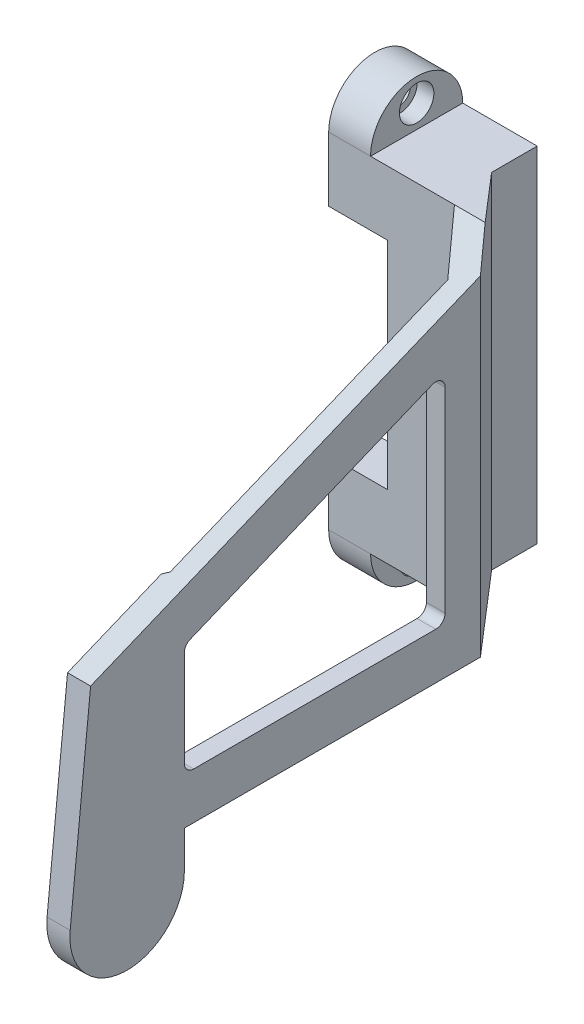
from build123d import *

# Parameters (mm, degrees)
SZKIC1_W                       = 9.9
SZKIC1_H                       = 37
DODANIE_WYCI_GNI_CIE1_DEPTH    = 12.5
DODANIE_WYCI_GNI_CIE2_DEPTH    = 7.5
WYTNIJ_WYCI_GNI_CIE1_START     = -47.15
WYTNIJ_WYCI_GNI_CIE1_OUTLINE_W = 17.51973865
WYTNIJ_WYCI_GNI_CIE1_OUTLINE_H = 49.213267073
WYTNIJ_WYCI_GNI_CIE1_DEPTH     = 47.15
SZKIC4_W                       = 6.3
SZKIC4_H                       = 23.2
WYTNIJ_WYCI_GNI_CIE2_DEPTH     = 57.5
BOSS_EXTRU_1_START             = -2.480261
ESQUISSE2_R                    = 1.8
BOSS_EXTRU_1_DEPTH             = 3
ENL_V_MAT_EXTRU_1_DEPTH        = 72.402310887
ESQUISSE4_W                    = 2.9
ESQUISSE4_H                    = 5.1
ENL_V_MAT_EXTRU_2_DEPTH        = 6.3
BOSS_EXTRU_2_DEPTH             = 37
ESQUISSE6_R                    = 1.1
BOSS_EXTRU_3_DEPTH             = 4.5
ENL_V_START                    = -1.8
ESQUISSE8_R                    = 1.85
ESQUISSE8_R_2                  = 1.1
ENL_V_MAT_EXTRU_5_DEPTH        = 1.8
BOSS_EXTRU_4_REACH             = 76.088
ENL_V_MAT_EXTRU_7_DEPTH        = 75.088410025
ENL_V_MAT_EXTRU_8_DEPTH        = 66.729440163


# Read off the part's stored shape, not the designer's step: Wytnij-wyciągnięcie1
with BuildPart() as part:
    # Szkic1 → Dodanie-wyciągnięcie1 (new body)
    with BuildSketch(Plane(origin=(0, 0, 0), x_dir=(0, 0, -1), z_dir=(1, 0, 0))):
        with Locations((-4.95, 18.5)):
            Rectangle(SZKIC1_W, SZKIC1_H)
    extrude(amount=DODANIE_WYCI_GNI_CIE1_DEPTH)

    # Szkic2 → Dodanie-wyciągnięcie2 (add)
    with BuildSketch(Plane(origin=(12.5, 0, 0), x_dir=(0, 0, -1), z_dir=(1, 0, 0))):
        with BuildLine():
            Line((-45.4, 0), (-7.4, 0))
            Line((-7.4, 0), (-7.4, 37))
            Line((-7.4, 37), (-9.9, 37))
            Line((-9.9, 37), (-55.472391365, 18.25))
            Line((-55.472391365, 18.25), (-57.668539629, -3.378732899))
            ThreePointArc((-57.668539629, -3.378732899), (-51.861031576, -10.142129872), (-45.4, -4))
            Line((-45.4, -4), (-45.4, 0))
        make_face()
    extrude(amount=DODANIE_WYCI_GNI_CIE2_DEPTH)

    # Wytnij-wyciągnięcie1 outline → Wytnij-wyciągnięcie1 (cut)
    with BuildSketch(Plane(origin=(0, 37, 0), x_dir=(1, 0, 0), z_dir=(0, 1, 0)).offset(WYTNIJ_WYCI_GNI_CIE1_START)):
        with Locations((8.759869325, -38.061906093)):
            Rectangle(WYTNIJ_WYCI_GNI_CIE1_OUTLINE_W, WYTNIJ_WYCI_GNI_CIE1_OUTLINE_H)
        Polygon((15, -7.4), (20, -12.4), (20, -7.4), align=None)
    extrude(amount=WYTNIJ_WYCI_GNI_CIE1_DEPTH, mode=Mode.SUBTRACT)

    # Szkic4 → Wytnij-wyciągnięcie2 (cut)
    with BuildSketch(Plane.XY.offset(9.9)):
        with Locations((3.15, 18.5)):
            Rectangle(SZKIC4_W, SZKIC4_H)
    extrude(amount=-WYTNIJ_WYCI_GNI_CIE2_DEPTH, mode=Mode.SUBTRACT)

    # Esquisse2 → Boss.-Extru.1 (add)
    with BuildSketch(Plane(origin=(20, 0, 0), x_dir=(0, 0, -1), z_dir=(1, 0, 0)).offset(BOSS_EXTRU_1_START)):
        with Locations((-51.55, -4)):
            Circle(ESQUISSE2_R)
    extrude(amount=-BOSS_EXTRU_1_DEPTH)

    # Esquisse3 → Enlèv. mat.-Extru.1 (cut, through all)
    with BuildSketch(Plane(origin=(20, 0, 0), x_dir=(0, 0, -1), z_dir=(1, 0, 0))):
        with BuildLine():
            Line((-17.4, 6), (-17.4, 27.014829056))
            ThreePointArc((-17.4, 27.014829056), (-17.843442614, 27.845638225), (-18.780487752, 27.939615015))
            Line((-18.780487752, 27.939615015), (-44.780487752, 17.242348855))
            ThreePointArc((-44.780487752, 17.242348855), (-45.230809169, 16.874120282), (-45.4, 16.317562896))
            Line((-45.4, 16.317562896), (-45.4, 6))
            ThreePointArc((-45.4, 6), (-45.107106781, 5.292893219), (-44.4, 5))
            Line((-44.4, 5), (-18.4, 5))
            ThreePointArc((-18.4, 5), (-17.692893219, 5.292893219), (-17.4, 6))
        make_face()
    extrude(amount=-ENL_V_MAT_EXTRU_1_DEPTH, mode=Mode.SUBTRACT)

    # Esquisse4 → Enlèv. mat.-Extru.2 (cut)
    with BuildSketch(Plane.ZY):
        with Locations((3.95, 32.65)):
            Rectangle(ESQUISSE4_W, ESQUISSE4_H)
        with Locations((3.95, 4.35)):
            Rectangle(ESQUISSE4_W, ESQUISSE4_H)
    extrude(amount=-ENL_V_MAT_EXTRU_2_DEPTH, mode=Mode.SUBTRACT)

    # Esquisse5 → Boss.-Extru.2 (add)
    with BuildSketch(Plane.XZ):
        Polygon((12.5, 4.9), (15, 7.4), (12.5, 7.4), align=None)
    extrude(amount=-BOSS_EXTRU_2_DEPTH)

    # Esquisse6 → Boss.-Extru.3 (add)
    # profile 1 of 3: a face of its own
    with BuildSketch(Plane.ZY):
        Polygon((2.5, 30.1), (2.5, 35.2), (5.4, 35.2), (5.4, 30.1), (9.9, 30.1), (9.9, 37), (0, 37), (0, 30.1), align=None)
    # profile 2 of 3: a face of its own
    with BuildSketch(Plane.ZY):
        with BuildLine():
            ThreePointArc((9.9, 37), (4.95, 41.95), (0, 37))
            Line((0, 37), (9.9, 37))
        make_face()
        with Locations((4.95, 39.475)):
            Circle(ESQUISSE6_R, mode=Mode.SUBTRACT)
    # profile 3 of 3: a face of its own
    with BuildSketch(Plane.ZY):
        with BuildLine():
            ThreePointArc((0, 0), (4.95, -4.95), (9.9, 0))
            Line((9.9, 0), (0, 0))
        make_face()
        with Locations((4.95, -2.475)):
            Circle(ESQUISSE6_R, mode=Mode.SUBTRACT)
    extrude(amount=-BOSS_EXTRU_3_DEPTH)

    # Esquisse8 → Enlèv. mat.-Extru.5 (cut)
    # profile 1 of 2: a face of its own
    with BuildSketch(Plane(origin=(4.5, 0, 0), x_dir=(0, 0, -1), z_dir=(1, 0, 0)).offset(ENL_V_START)):
        with Locations((-4.95, 39.475)):
            Circle(ESQUISSE8_R)
        with Locations(Location((-4.95, 39.475, 0), (0, 0, 180))):
            Circle(ESQUISSE8_R_2, mode=Mode.SUBTRACT)
    # profile 2 of 2: a face of its own
    with BuildSketch(Plane(origin=(4.5, 0, 0), x_dir=(0, 0, -1), z_dir=(1, 0, 0)).offset(ENL_V_START)):
        with Locations((-4.95, -2.475)):
            Circle(ESQUISSE8_R)
        with Locations(Location((-4.95, -2.475, 0), (0, 0, 180))):
            Circle(ESQUISSE8_R_2, mode=Mode.SUBTRACT)
    extrude(amount=ENL_V_MAT_EXTRU_5_DEPTH, mode=Mode.SUBTRACT)

    # Boss.-Extru.4: up to this face of the body (flat: up to its plane)
    boss_extru_4_end = Plane(part.part.faces().sort_by_distance((9.272446383, 37, 5.397564522))[0])
    # Esquisse10 → Boss.-Extru.4 (add, up to the picked face)
    with BuildSketch(Plane.XZ, mode=Mode.PRIVATE) as boss_extru_4_sk1:
        Polygon((20, 0), (12.5, 0), (12.5, 4.9), (20, 12.4), align=None)
    boss_extru_4_tool1 = split(extrude(boss_extru_4_sk1.sketch, amount=-BOSS_EXTRU_4_REACH, mode=Mode.PRIVATE), bisect_by=boss_extru_4_end, keep=Keep.BOTH, mode=Mode.PRIVATE)
    # Esquisse10 → Boss.-Extru.4 (add, up to the picked face)
    with BuildSketch(Plane.XZ, mode=Mode.PRIVATE) as boss_extru_4_sk2:
        Polygon((17.51973865, 13.455272556), (17.51973865, 18.475011205), (12.5, 13.455272556), align=None)
    boss_extru_4_tool2 = split(extrude(boss_extru_4_sk2.sketch, amount=-BOSS_EXTRU_4_REACH, mode=Mode.PRIVATE), bisect_by=boss_extru_4_end, keep=Keep.BOTH, mode=Mode.PRIVATE)
    add(boss_extru_4_tool1.solids().sort_by(Axis((16.791908, 0, 4.595954), (0, 1, 0)))[0])
    add(boss_extru_4_tool2.solids().sort_by(Axis((15.846492, 0, 15.128519), (0, 1, 0)))[0])

    # Esquisse11 → Enlèv. mat.-Extru.7 (cut, through all)
    with BuildSketch(Plane.XZ):
        Polygon((17.51973865, 18.475011205), (18, 18.955272556), (18, 44.91973865), (17.51973865, 45.4), align=None)
        Polygon((12.5, 13.455272556), (12.5, 9.9), (13.509622462, 9.9), (17.51973865, 14.551734777), (17.51973865, 18.475011205), align=None)
        Polygon((17.51973865, 14.551734777), (18, 15.108837944), (18, 18.955272556), (17.51973865, 18.475011205), align=None)
        Polygon((12.5, 4.9), (12.5, 0), (20, 0), (20, 13.6), align=None)
    extrude(amount=-ENL_V_MAT_EXTRU_7_DEPTH, mode=Mode.SUBTRACT)

    # Esquisse12 → Enlèv. mat.-Extru.8 (cut, through all)
    with BuildSketch(Plane(origin=(0, 35.126985948, 14.452412235), x_dir=(1, 0, 0), z_dir=(0, 0.9247859593811136, 0.3804877518811259))):
        Polygon((20, -44.356187196), (20, 0.921740026), (16.810344828, 4.922665822), (13.509622462, 4.922665822), (16.574512596, 1.078238341), (17.51973865, 1.078238341), (17.51973865, -0.107400574), (18, -0.709813663), (18, -32.945273559), (17.51973865, -33.464595187), (17.51973865, -44.356187196), align=None)
        Polygon((16.574512596, 1.078238341), (17.51973865, -0.107400574), (17.51973865, 1.078238341), align=None)
    extrude(amount=ENL_V_MAT_EXTRU_8_DEPTH, mode=Mode.SUBTRACT)


solid = part.part
